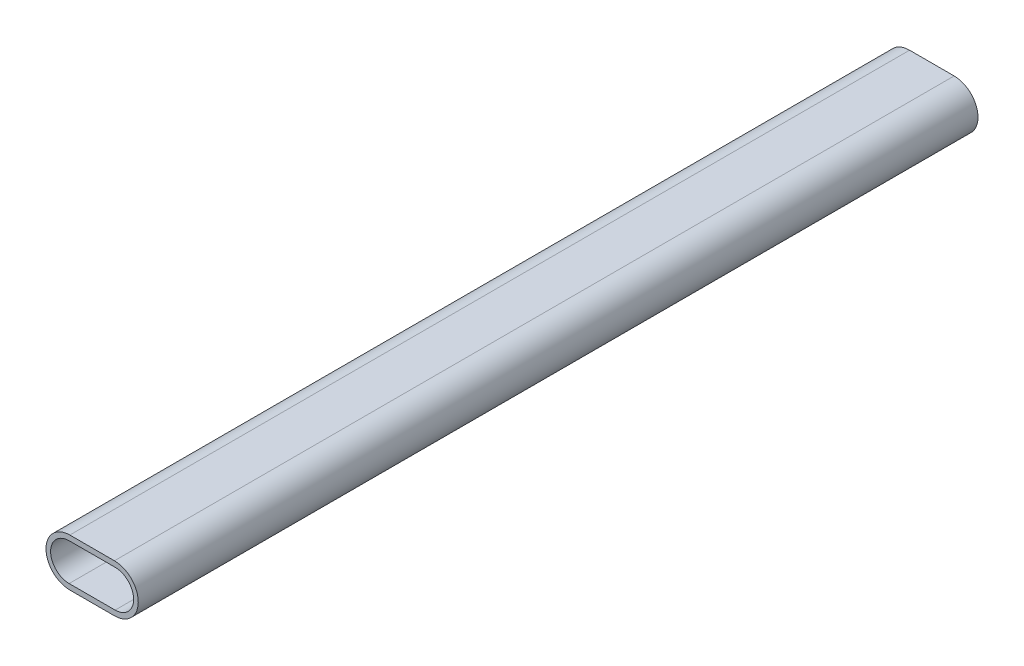
from build123d import *

# Parameters (mm, degrees)
BOSS_EXTRUDE1_DEPTH     = 273.05
CUT_EXTRUDE1_DEPTH      = 274.571498881
CUT_EXTRUDE1_DEPTH_BACK = 274.571498881


with BuildPart() as part:
    # Sketch1 → Boss-Extrude1 (new body)
    with BuildSketch(Plane.XY):
        with BuildLine():
            Line((-7.25, 7.75), (7.25, 7.75))
            ThreePointArc((7.25, 7.75), (15, 0), (7.25, -7.75))
            Line((7.25, -7.75), (-7.25, -7.75))
            ThreePointArc((-7.25, -7.75), (-15, 0), (-7.25, 7.75))
        make_face()
    extrude(amount=BOSS_EXTRUDE1_DEPTH)

    # Sketch2 → Cut-Extrude1 (cut, two sides: drawn at the far end of the back side and taken through both)
    with BuildSketch(Plane.XY.offset(273.05).offset(-CUT_EXTRUDE1_DEPTH_BACK)):
        with BuildLine():
            Line((-7.475, 6.025), (7.475, 6.025))
            ThreePointArc((7.475, 6.025), (13.5, 0), (7.475, -6.025))
            Line((7.475, -6.025), (-7.475, -6.025))
            ThreePointArc((-7.475, -6.025), (-13.5, 0), (-7.475, 6.025))
        make_face()
    extrude(amount=CUT_EXTRUDE1_DEPTH + CUT_EXTRUDE1_DEPTH_BACK, mode=Mode.SUBTRACT)


solid = part.part
